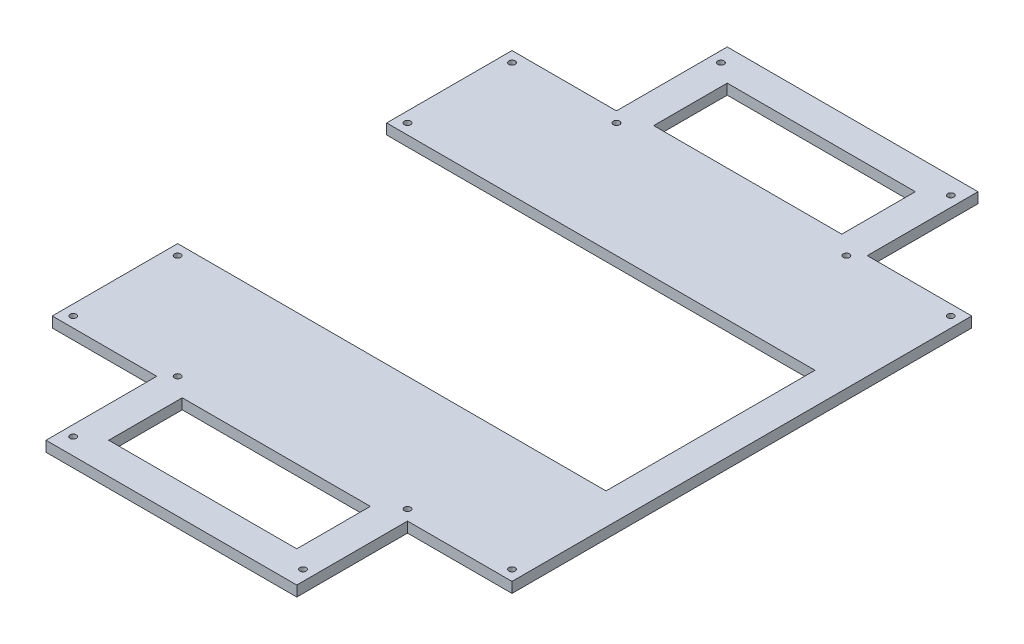
from build123d import *

# Parameters (mm, degrees)
ESQUISSE1_R        = 1.5
ESQUISSE1_W        = 90
ESQUISSE1_H        = 35.2
BOSS_EXTRU_1_DEPTH = 5


with BuildPart() as part:
    # Esquisse1 → Boss.-Extru.1 (new body)
    with BuildSketch(Plane(origin=(0, 0, 0), x_dir=(1, 0, 0), z_dir=(0, 1, 0))):
        Polygon((-60, 110), (-60, 163), (60, 163), (60, 110), (110, 110), (110, -110), (60, -110), (60, -163), (-60, -163), (-60, -110), (-110, -110), (-110, -50), (95, -50), (95, 50), (-110, 50), (-110, 110), align=None)
        with Locations((-105, -105)):
            Circle(ESQUISSE1_R, mode=Mode.SUBTRACT)
        with Locations((-105, -55)):
            Circle(ESQUISSE1_R, mode=Mode.SUBTRACT)
        with Locations((-55, -105)):
            Circle(ESQUISSE1_R, mode=Mode.SUBTRACT)
        with Locations((-55, -155)):
            Circle(ESQUISSE1_R, mode=Mode.SUBTRACT)
        with Locations((-55, 105)):
            Circle(ESQUISSE1_R, mode=Mode.SUBTRACT)
        with Locations((-105, 105)):
            Circle(ESQUISSE1_R, mode=Mode.SUBTRACT)
        with Locations((-105, 55)):
            Circle(ESQUISSE1_R, mode=Mode.SUBTRACT)
        with Locations((55, -155)):
            Circle(ESQUISSE1_R, mode=Mode.SUBTRACT)
        with Locations((55, -105)):
            Circle(ESQUISSE1_R, mode=Mode.SUBTRACT)
        with Locations((105, -105)):
            Circle(ESQUISSE1_R, mode=Mode.SUBTRACT)
        with Locations((105, 105)):
            Circle(ESQUISSE1_R, mode=Mode.SUBTRACT)
        with Locations((55, 105)):
            Circle(ESQUISSE1_R, mode=Mode.SUBTRACT)
        with Locations((-55, 155)):
            Circle(ESQUISSE1_R, mode=Mode.SUBTRACT)
        with Locations((55, 155)):
            Circle(ESQUISSE1_R, mode=Mode.SUBTRACT)
        with Locations((0, -130.4)):
            Rectangle(ESQUISSE1_W, ESQUISSE1_H, mode=Mode.SUBTRACT)
        with Locations((0, 130.4)):
            Rectangle(ESQUISSE1_W, ESQUISSE1_H, mode=Mode.SUBTRACT)
    extrude(amount=BOSS_EXTRU_1_DEPTH)


solid = part.part
